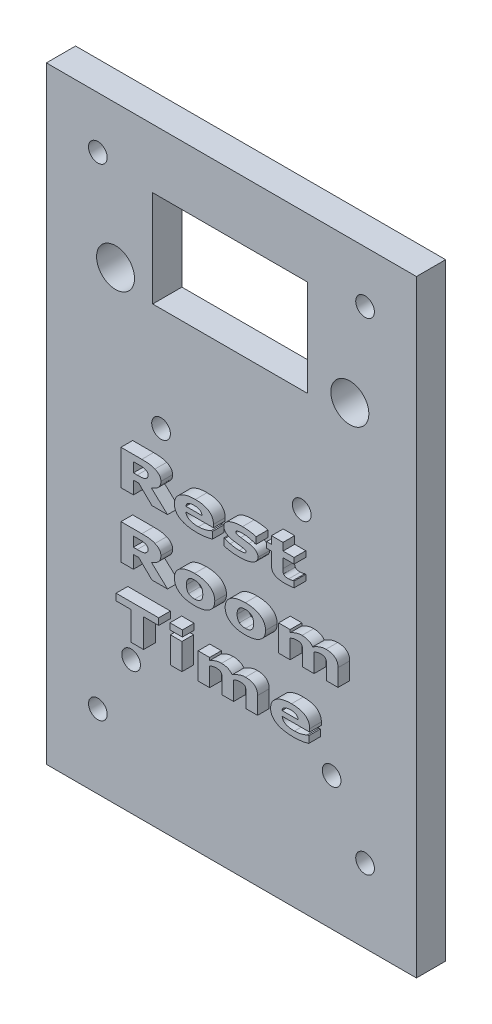
from build123d import *

# Parameters (mm, degrees)
SCHIZZO1_W                   = 63.340006879
SCHIZZO1_H                   = 103.980003745
SCHIZZO1_R                   = 1.6
SCHIZZO1_R_2                 = 3.25
SCHIZZO1_W_2                 = 26.5
SCHIZZO1_H_2                 = 16.5
ESTRUSIONE_ESTRUSIONE1_DEPTH = 5
SCHIZZO4_W                   = 1.974683544
SCHIZZO4_H                   = 4.481012658
SCHIZZO4_W_2                 = 2.126582278
SCHIZZO4_H_2                 = 1.063291139
ESTRUSIONE_ESTRUSIONE2_DEPTH = 2
SCHIZZO5_W                   = 53.340006879
SCHIZZO5_H                   = 93.980003745
SCHIZZO5_W_2                 = 48.340006879
SCHIZZO5_H_2                 = 88.980003745
TAGLIO_ESTRUSIONE1_DEPTH     = 2


with BuildPart() as part:
    # Schizzo1 → Estrusione-Estrusione1 (new body)
    with BuildSketch(Plane.XY):
        with Locations((45.670002815, -4.009999784)):
            Rectangle(SCHIZZO1_W, SCHIZZO1_H)
        with Locations((68.547653378, 39.133270494)):
            Circle(SCHIZZO1_R, mode=Mode.SUBTRACT)
        with Locations((22.813532798, 39.133270494)):
            Circle(SCHIZZO1_R, mode=Mode.SUBTRACT)
        with Locations((68.547653378, -43.377075301)):
            Circle(SCHIZZO1_R, mode=Mode.SUBTRACT)
        with Locations((22.813532798, -43.377075301)):
            Circle(SCHIZZO1_R, mode=Mode.SUBTRACT)
        with Locations((57.711115818, 3.59770492)):
            Circle(SCHIZZO1_R, mode=Mode.SUBTRACT)
        with Locations((33.630602395, 3.59770492)):
            Circle(SCHIZZO1_R, mode=Mode.SUBTRACT)
        with Locations((62.830042897, -33.235000951)):
            Circle(SCHIZZO1_R, mode=Mode.SUBTRACT)
        with Locations((28.504233864, -33.235000951)):
            Circle(SCHIZZO1_R, mode=Mode.SUBTRACT)
        with Locations((65.944072664, 23.559058576)):
            Circle(SCHIZZO1_R_2, mode=Mode.SUBTRACT)
        with Locations((25.84132705, 23.559058576)):
            Circle(SCHIZZO1_R_2, mode=Mode.SUBTRACT)
        with Locations((45.449738172, 29.587574645)):
            Rectangle(SCHIZZO1_W_2, SCHIZZO1_H_2, mode=Mode.SUBTRACT)
    extrude(amount=ESTRUSIONE_ESTRUSIONE1_DEPTH)

    # Schizzo4 → Estrusione-Estrusione2 (add)
    # profile 1 of 13: a face of its own
    with BuildSketch(Plane.XY.offset(5)):
        with BuildLine():
            Line((36.743529831, -6.613542925), (34.068688059, -6.613542925))
            Line((34.068688059, -6.613542925), (31.812754515, -4.411011279))
            Line((31.812754515, -4.411011279), (30.895428566, -4.411011279))
            Line((30.895428566, -4.411011279), (30.895428566, -6.613542925))
            Line((30.895428566, -6.613542925), (28.768846287, -6.613542925))
            Line((28.768846287, -6.613542925), (28.768846287, -0.613542925))
            Line((28.768846287, -0.613542925), (32.342026667, -0.613542925))
            add(Edge.make_bspline(
                [(32.342026667, -0.613542925), (32.459917396, -0.614065362), (32.687061621, -0.615071962), (33.014707426, -0.627201677), (33.316628657, -0.646115842), (33.596480416, -0.670828345), (33.859504462, -0.709843996), (34.111568341, -0.765611436), (34.354933893, -0.839725052), (34.510982371, -0.903482808), (34.58846654, -0.935141026)],
                knots=[0, 0, 0, 0, 1.23763299, 2.384591115, 3.441523635, 4.413457851, 5.333214875, 6.23095678, 7.121600885, 8, 8, 8, 8], degree=3))
            add(Edge.make_bspline(
                [(34.58846654, -0.935141026), (34.662828165, -0.969611464), (34.807841098, -1.036832417), (35.006453319, -1.160387443), (35.180486974, -1.299726487), (35.308001287, -1.427449365), (35.393939486, -1.539598071), (35.451893666, -1.626664821), (35.497379626, -1.720773675), (35.537878824, -1.818112565), (35.566214003, -1.92203166), (35.590097133, -2.029912661), (35.600937137, -2.143785518), (35.603154715, -2.221124715), (35.604289325, -2.260694823)],
                knots=[0, 0, 0, 0, 1.65530834, 3.228024117, 4.71244356, 6.153967778, 6.860706657, 7.565816059, 8.262950144, 8.969553376, 9.693180251, 10.436325727, 11.199956013, 12, 12, 12, 12], degree=3))
            add(Edge.make_bspline(
                [(35.604289325, -2.260694823), (35.602767665, -2.314937192), (35.599792592, -2.42098913), (35.581007834, -2.576490305), (35.547714136, -2.723907142), (35.501214741, -2.863858666), (35.441582966, -2.996281934), (35.369088258, -3.121344871), (35.283182432, -3.238364413), (35.183481498, -3.346628478), (35.072017716, -3.448893568), (34.949789808, -3.547571155), (34.815440793, -3.641008215), (34.670029412, -3.729809198), (34.514393144, -3.815737256), (34.346653152, -3.896133921), (34.167645578, -3.972147018), (34.043190376, -4.017576773), (33.979684895, -4.040758114)],
                knots=[0, 0, 0, 0, 1.003039821, 1.961092798, 2.890919865, 3.793002064, 4.683474046, 5.571690105, 6.461170186, 7.362065434, 8.288578113, 9.256133225, 10.264625474, 11.312124791, 12.4055062, 13.550515092, 14.750106724, 16, 16, 16, 16], degree=3))
            Line((33.979684895, -4.040758114), (36.743529831, -6.613542925))
        make_face()
        with BuildLine():
            add(Edge.make_bspline(
                [(33.401757679, -2.435141026), (33.400163439, -2.397433093), (33.397058864, -2.324001806), (33.372906305, -2.218463078), (33.333005692, -2.121309999), (33.276775361, -2.03189924), (33.199310679, -1.951165726), (33.098636165, -1.881875055), (32.976622049, -1.819646491), (32.885249284, -1.789117141), (32.836884262, -1.772957482)],
                knots=[0, 0, 0, 0, 0.957336641, 1.864288378, 2.734003876, 3.615026844, 4.532001674, 5.555423495, 6.706047712, 8, 8, 8, 8], degree=3))
            add(Edge.make_bspline(
                [(32.836884262, -1.772957482), (32.799824847, -1.762565898), (32.723162959, -1.741069648), (32.60178078, -1.717729622), (32.470926396, -1.701469455), (32.330669185, -1.691468736), (32.18029154, -1.684566442), (32.01887425, -1.679817453), (31.845591764, -1.677797806), (31.72612502, -1.677162318), (31.664415907, -1.676834064)],
                knots=[0, 0, 0, 0, 0.782320133, 1.618323976, 2.510186495, 3.462012448, 4.476573932, 5.570889699, 6.745272239, 8, 8, 8, 8], degree=3))
            Line((31.664415907, -1.676834064), (30.895428566, -1.676834064))
            Line((30.895428566, -1.676834064), (30.895428566, -3.34772014))
            Line((30.895428566, -3.34772014), (31.548118439, -3.34772014))
            add(Edge.make_bspline(
                [(31.548118439, -3.34772014), (31.629613777, -3.347352654), (31.785517863, -3.346649638), (32.00903549, -3.33896879), (32.211747148, -3.329325352), (32.395205307, -3.313105542), (32.561753371, -3.289196691), (32.71344567, -3.252820422), (32.851214785, -3.20325966), (32.934997751, -3.159926151), (32.975729198, -3.13885938)],
                knots=[0, 0, 0, 0, 1.341483331, 2.566315284, 3.681365401, 4.681825093, 5.597229588, 6.448502128, 7.24573266, 8, 8, 8, 8], degree=3))
            add(Edge.make_bspline(
                [(32.975729198, -3.13885938), (33.01056931, -3.117347666), (33.077069526, -3.076287704), (33.166378694, -3.006894065), (33.240036722, -2.933484302), (33.30108752, -2.855377251), (33.347094518, -2.767901896), (33.37871239, -2.668321342), (33.399466087, -2.556252424), (33.400969847, -2.476778222), (33.401757679, -2.435141026)],
                knots=[0, 0, 0, 0, 1.127439998, 2.151973666, 3.107421081, 3.985748692, 4.872887039, 5.813618488, 6.854536536, 8, 8, 8, 8], degree=3))
        make_face(mode=Mode.SUBTRACT)
    # profile 2 of 13: a face of its own
    with BuildSketch(Plane.XY.offset(5)):
        with BuildLine():
            Line((44.596694388, -4.63885938), (39.887833629, -4.63885938))
            add(Edge.make_bspline(
                [(39.887833629, -4.63885938), (39.893060666, -4.683751557), (39.903309035, -4.771769222), (39.93735581, -4.899002348), (39.985522596, -5.018380422), (40.05117156, -5.128532514), (40.129703915, -5.23161132), (40.224572371, -5.325825245), (40.334527932, -5.411190349), (40.459022346, -5.488611876), (40.598703229, -5.557899691), (40.754626468, -5.615929153), (40.925092606, -5.668006791), (41.111607302, -5.70679434), (41.313159104, -5.738942527), (41.529747206, -5.762763991), (41.762289885, -5.775186329), (41.92223466, -5.777106964), (42.004922236, -5.778099887)],
                knots=[0, 0, 0, 0, 0.815752726, 1.5994023, 2.371922207, 3.134423876, 3.90928801, 4.707855741, 5.542889771, 6.419503006, 7.352907879, 8.355149581, 9.422489183, 10.570699908, 11.793989706, 13.109817466, 14.505845598, 16, 16, 16, 16], degree=3))
            add(Edge.make_bspline(
                [(42.004922236, -5.778099887), (42.111809273, -5.776079306), (42.324875807, -5.77205152), (42.64118628, -5.738671201), (42.95294425, -5.686935661), (43.254423725, -5.61352446), (43.537245144, -5.527890777), (43.793709496, -5.439239935), (44.018767743, -5.348376994), (44.154472464, -5.279000308), (44.218134262, -5.246454317)],
                knots=[0, 0, 0, 0, 1.116833883, 2.226274866, 3.32050695, 4.417476773, 5.466421047, 6.407786068, 7.253060613, 8, 8, 8, 8], degree=3))
            Line((44.218134262, -5.246454317), (44.444795654, -5.246454317))
            Line((44.444795654, -5.246454317), (44.444795654, -6.395188494))
            add(Edge.make_bspline(
                [(44.444795654, -6.395188494), (44.333069665, -6.42649208), (44.113327136, -6.488059932), (43.786051191, -6.564270257), (43.468749928, -6.628840288), (43.15740151, -6.681231703), (42.842560588, -6.719235554), (42.516023671, -6.746680506), (42.173177741, -6.761529855), (41.939270694, -6.764119116), (41.819795654, -6.765441659)],
                knots=[0, 0, 0, 0, 1.046505789, 2.058266218, 3.03026014, 3.967069247, 4.90533822, 5.890014156, 6.922261439, 8, 8, 8, 8], degree=3))
            add(Edge.make_bspline(
                [(41.819795654, -6.765441659), (41.666668626, -6.763698158), (41.369627981, -6.760316059), (40.937402893, -6.732007126), (40.533083103, -6.683307625), (40.155667024, -6.61856805), (39.806704506, -6.531064245), (39.484003319, -6.42835347), (39.189318525, -6.303406355), (38.964265185, -6.182145397), (38.798661336, -6.076906004), (38.68485766, -5.993165278), (38.577787187, -5.907451021), (38.479899714, -5.81582678), (38.388548834, -5.722039991), (38.306107374, -5.622485429), (38.231714089, -5.519113566), (38.162897943, -5.412687971), (38.105913599, -5.29995516), (38.052466259, -5.185631144), (38.01033072, -5.065669352), (37.974327411, -4.942604318), (37.947370565, -4.814774608), (37.927051488, -4.683301084), (37.914903792, -4.547713633), (37.913739016, -4.456130578), (37.913150085, -4.40982457)],
                knots=[0, 0, 0, 0, 2.156393342, 4.183039893, 6.096393803, 7.889708536, 9.571876182, 11.159187607, 12.654365993, 14.072667969, 14.754162861, 15.416044098, 16.061618173, 16.684462124, 17.303031152, 17.904325619, 18.502722763, 19.096198601, 19.686738758, 20.280110001, 20.872198447, 21.475193746, 22.084894033, 22.710472495, 23.347992148, 24, 24, 24, 24], degree=3))
            add(Edge.make_bspline(
                [(37.913150085, -4.40982457), (37.916033268, -4.318643586), (37.921673664, -4.140265431), (37.968348047, -3.880016597), (38.04271935, -3.634211536), (38.147754463, -3.402633719), (38.285396009, -3.187429284), (38.451029413, -2.985683068), (38.648019514, -2.800014884), (38.872516582, -2.628960793), (39.124463166, -2.477525594), (39.397961199, -2.341922539), (39.69574842, -2.231783687), (40.013964096, -2.1385895), (40.355107656, -2.06877487), (40.717515135, -2.01584886), (41.10295434, -1.987150618), (41.367220577, -1.982843575), (41.502944388, -1.980631532)],
                knots=[0, 0, 0, 0, 0.900707721, 1.762062369, 2.604321683, 3.433667978, 4.2667202, 5.122278432, 6.007259721, 6.936273877, 7.906562426, 8.908506855, 9.949130078, 11.040455975, 12.183024346, 13.387882921, 14.658449562, 16, 16, 16, 16], degree=3))
            add(Edge.make_bspline(
                [(41.502944388, -1.980631532), (41.627596517, -1.982027035), (41.868887111, -1.984728325), (42.219174348, -2.011122042), (42.5453233, -2.054505932), (42.848204993, -2.114142502), (43.126698946, -2.192525999), (43.38197635, -2.286464764), (43.613050703, -2.39983624), (43.820072491, -2.530172734), (44.003866017, -2.676926677), (44.162329819, -2.840486519), (44.297755343, -3.01816296), (44.408473738, -3.211422576), (44.492619725, -3.420938427), (44.552644245, -3.64525745), (44.590712442, -3.884401989), (44.594666014, -4.048917167), (44.596694388, -4.133321406)],
                knots=[0, 0, 0, 0, 1.401136945, 2.712197293, 3.946129402, 5.098199997, 6.179386588, 7.195357877, 8.15196001, 9.067385085, 9.940371348, 10.789472137, 11.621064783, 12.445672393, 13.285499767, 14.151743494, 15.051755079, 16, 16, 16, 16], degree=3))
            Line((44.596694388, -4.133321406), (44.596694388, -4.63885938))
        make_face()
        with BuildLine():
            add(Edge.make_bspline(
                [(42.622010844, -3.803416342), (42.619492739, -3.769718624), (42.614602945, -3.704282555), (42.596696457, -3.609493848), (42.569439691, -3.521005065), (42.532564246, -3.439008375), (42.486977504, -3.363139533), (42.432238369, -3.293814095), (42.367094422, -3.231793211), (42.293299234, -3.17563767), (42.208958738, -3.126866479), (42.114360863, -3.083994324), (42.009051854, -3.047703609), (41.892805284, -3.017800267), (41.766097171, -2.996234936), (41.628734711, -2.979184574), (41.480515579, -2.970225079), (41.377954581, -2.968740647), (41.324938059, -2.967973304)],
                knots=[0, 0, 0, 0, 0.932139821, 1.810080023, 2.656144755, 3.482032483, 4.285310903, 5.093545367, 5.912038884, 6.761478327, 7.647191353, 8.59505604, 9.624025466, 10.717690014, 11.904201741, 13.169053196, 14.536607931, 16, 16, 16, 16], degree=3))
            add(Edge.make_bspline(
                [(41.324938059, -2.967973304), (41.275095204, -2.96889922), (41.177715741, -2.970708208), (41.03493263, -2.977740355), (40.899754589, -2.995637761), (40.77065808, -3.01580389), (40.649035231, -3.045245989), (40.532799292, -3.076963611), (40.425111322, -3.120042402), (40.322818579, -3.164732973), (40.230021724, -3.218268189), (40.146856655, -3.278809887), (40.07590112, -3.348217115), (40.013458079, -3.423780163), (39.964517796, -3.508457613), (39.924142194, -3.599642006), (39.897371889, -3.69904615), (39.887137184, -3.768087751), (39.881900085, -3.803416342)],
                knots=[0, 0, 0, 0, 1.299904305, 2.539661586, 3.72426531, 4.853518015, 5.944294499, 6.985577514, 7.991157631, 8.965086312, 9.893841863, 10.778785638, 11.639476424, 12.47546522, 13.326273753, 14.180824864, 15.069127983, 16, 16, 16, 16], degree=3))
            Line((39.881900085, -3.803416342), (42.622010844, -3.803416342))
        make_face(mode=Mode.SUBTRACT)
    # profile 3 of 13: a face of its own
    with BuildSketch(Plane.XY.offset(5)):
        with BuildLine():
            add(Edge.make_bspline(
                [(52.222010844, -5.202546089), (52.219759639, -5.259779994), (52.215289189, -5.373435266), (52.171465098, -5.538536279), (52.10322149, -5.695451659), (52.006262024, -5.842761263), (51.882712387, -5.981396057), (51.730673112, -6.109133059), (51.554164487, -6.231268974), (51.34993382, -6.340684683), (51.123900658, -6.441951503), (50.875572747, -6.527246215), (50.608550918, -6.60306266), (50.320166873, -6.660538395), (50.01305497, -6.708681669), (49.685380157, -6.740862984), (49.33817694, -6.761387051), (49.099810736, -6.764067046), (48.977548819, -6.765441659)],
                knots=[0, 0, 0, 0, 0.695242776, 1.380615357, 2.063956096, 2.770310233, 3.517108837, 4.316009042, 5.181306846, 6.124909698, 7.131333953, 8.192534391, 9.317354372, 10.50696049, 11.768581374, 13.099289541, 14.512178257, 16, 16, 16, 16], degree=3))
            add(Edge.make_bspline(
                [(48.977548819, -6.765441659), (48.841843033, -6.764035279), (48.576606863, -6.761286519), (48.188237403, -6.741012128), (47.819134115, -6.707419505), (47.472229866, -6.658356537), (47.152005575, -6.601385712), (46.862649801, -6.542513841), (46.605981007, -6.482223014), (46.448071401, -6.434306351), (46.373909578, -6.411802418)],
                knots=[0, 0, 0, 0, 1.235089918, 2.413976085, 3.538525044, 4.607254729, 5.601666222, 6.498392537, 7.294774088, 8, 8, 8, 8], degree=3))
            Line((46.373909578, -6.411802418), (46.373909578, -5.246454317))
            Line((46.373909578, -5.246454317), (46.557849452, -5.246454317))
            add(Edge.make_bspline(
                [(46.557849452, -5.246454317), (46.611573922, -5.270743303), (46.72635179, -5.322634706), (46.877916982, -5.387711741), (47.019478709, -5.44169241), (47.14919495, -5.485596462), (47.299375731, -5.530096633), (47.406669505, -5.558822172), (47.463308312, -5.573985963)],
                knots=[0, 0, 0, 0, 1.100340934, 2.350787024, 3.077434952, 3.92718755, 4.905792744, 6, 6, 6, 6], degree=3))
            add(Edge.make_bspline(
                [(47.463308312, -5.573985963), (47.517039357, -5.587705159), (47.627309821, -5.615860617), (47.798560596, -5.654001114), (47.980385496, -5.687786442), (48.17162685, -5.720328692), (48.372215324, -5.746941947), (48.580204421, -5.763384607), (48.795024251, -5.776621064), (48.940342888, -5.777600946), (49.014336793, -5.778099887)],
                knots=[0, 0, 0, 0, 0.848309791, 1.74095843, 2.683297014, 3.677135311, 4.708439524, 5.777335295, 6.868254989, 8, 8, 8, 8], degree=3))
            add(Edge.make_bspline(
                [(49.014336793, -5.778099887), (49.061810096, -5.777998935), (49.153618523, -5.777803706), (49.286557029, -5.772731476), (49.410387776, -5.765593511), (49.524487392, -5.756907449), (49.628903859, -5.743378282), (49.723532074, -5.728177612), (49.809353642, -5.711001403), (49.885296985, -5.68939827), (49.952748725, -5.666161205), (50.010314846, -5.638660392), (50.060257078, -5.61078623), (50.100387076, -5.578207006), (50.131050392, -5.5424571), (50.155165002, -5.505046581), (50.168355745, -5.463675054), (50.170366007, -5.435222807), (50.171377933, -5.42090052)],
                knots=[0, 0, 0, 0, 1.754922561, 3.393837643, 4.917246669, 6.340576006, 7.622979822, 8.808233368, 9.883757409, 10.855995801, 11.725592256, 12.517173403, 13.211921573, 13.835453321, 14.416003467, 14.947716567, 15.470301736, 16, 16, 16, 16], degree=3))
            add(Edge.make_bspline(
                [(50.171377933, -5.42090052), (50.169465997, -5.394834868), (50.165781521, -5.344603975), (50.132515241, -5.274756339), (50.07631431, -5.219017632), (50.013917362, -5.185020276), (49.95421608, -5.160395902), (49.89743471, -5.143340176), (49.832053836, -5.124035233), (49.756619492, -5.106697862), (49.672344955, -5.088960016), (49.578314458, -5.070713728), (49.474359663, -5.055139126), (49.401984416, -5.043588994), (49.364415907, -5.037593558)],
                knots=[0, 0, 0, 0, 0.965884004, 1.86134671, 2.808544282, 3.863828688, 4.484314242, 5.21050087, 6.067767429, 7.021007244, 8.089147759, 9.272750088, 10.584340436, 12, 12, 12, 12], degree=3))
            add(Edge.make_bspline(
                [(49.364415907, -5.037593558), (49.324099664, -5.031045126), (49.236510854, -5.016818371), (49.09467642, -4.998901761), (48.932639328, -4.977869647), (48.755117156, -4.959561323), (48.572231212, -4.937859806), (48.393959777, -4.91228807), (48.223911272, -4.887300137), (48.113956204, -4.866292976), (48.060222869, -4.856027102)],
                knots=[0, 0, 0, 0, 0.744214768, 1.616839283, 2.604767253, 3.721554734, 4.868636585, 5.960393255, 7.003275847, 8, 8, 8, 8], degree=3))
            add(Edge.make_bspline(
                [(48.060222869, -4.856027102), (47.990861021, -4.842418086), (47.856247502, -4.816006485), (47.662607813, -4.767187361), (47.482717975, -4.712759097), (47.316781702, -4.652380711), (47.163937054, -4.587226137), (47.02476711, -4.516456264), (46.899883219, -4.439228859), (46.788348683, -4.357079663), (46.690331894, -4.269035068), (46.605770632, -4.17501326), (46.533952194, -4.0760697), (46.475020726, -3.971930688), (46.429734569, -3.862253207), (46.397987439, -3.747044893), (46.376557954, -3.626998476), (46.374799989, -3.544808351), (46.373909578, -3.503179001)],
                knots=[0, 0, 0, 0, 1.436910973, 2.788674871, 4.058194714, 5.256528725, 6.376980573, 7.434471268, 8.427648006, 9.358983182, 10.247307462, 11.101556827, 11.925237091, 12.728280823, 13.528823734, 14.330860009, 15.154579535, 16, 16, 16, 16], degree=3))
            add(Edge.make_bspline(
                [(46.373909578, -3.503179001), (46.376248574, -3.449506646), (46.380891302, -3.342971103), (46.423608555, -3.187685491), (46.491101019, -3.039374353), (46.586073027, -2.898250466), (46.709659443, -2.766141291), (46.858210731, -2.640273829), (47.032333383, -2.519985116), (47.233281544, -2.409836505), (47.456226844, -2.308022809), (47.700687622, -2.22087344), (47.963940549, -2.146168601), (48.246887201, -2.084633102), (48.549676286, -2.037633286), (48.871756193, -2.005237596), (49.213040831, -1.984657171), (49.447059187, -1.981998217), (49.567343123, -1.980631532)],
                knots=[0, 0, 0, 0, 0.66642162, 1.322796246, 1.987745069, 2.686423757, 3.428127259, 4.230760498, 5.104236181, 6.055709831, 7.077361036, 8.149694254, 9.280365811, 10.478985555, 11.748965885, 13.089424735, 14.503982965, 16, 16, 16, 16], degree=3))
            add(Edge.make_bspline(
                [(49.567343123, -1.980631532), (49.68287515, -1.981676304), (49.912120572, -1.9837494), (50.252196788, -2.003200245), (50.585093267, -2.035176637), (50.905891936, -2.07902864), (51.205807856, -2.128955888), (51.47517122, -2.182516027), (51.709787791, -2.235134647), (51.852344221, -2.277778787), (51.918213376, -2.297482798)],
                knots=[0, 0, 0, 0, 1.165069486, 2.311799166, 3.434006637, 4.537017677, 5.576539971, 6.499751617, 7.306800165, 8, 8, 8, 8], degree=3))
            Line((51.918213376, -2.297482798), (51.918213376, -3.423669507))
            Line((51.918213376, -3.423669507), (51.744953882, -3.423669507))
            add(Edge.make_bspline(
                [(51.744953882, -3.423669507), (51.668599182, -3.390646175), (51.512182518, -3.322996124), (51.264538476, -3.238103965), (51.002453351, -3.158930792), (50.726528106, -3.092746999), (50.442587798, -3.036078511), (50.153990461, -2.997791917), (49.863665366, -2.972937137), (49.669450724, -2.969630792), (49.572089958, -2.967973304)],
                knots=[0, 0, 0, 0, 0.892773515, 1.82889402, 2.808358008, 3.831127153, 4.873846771, 5.915251133, 6.954905017, 8, 8, 8, 8], degree=3))
            add(Edge.make_bspline(
                [(49.572089958, -2.967973304), (49.494534739, -2.969173473), (49.345563467, -2.971478808), (49.131346621, -2.987199505), (48.936308926, -3.016980336), (48.787338619, -3.050586907), (48.680508808, -3.082190395), (48.61339279, -3.109661583), (48.555609248, -3.137583681), (48.508140242, -3.168675052), (48.470733635, -3.202906151), (48.444107581, -3.240067292), (48.426800933, -3.279837812), (48.425300237, -3.307596389), (48.42454249, -3.321612545)],
                knots=[0, 0, 0, 0, 2.189436495, 4.205560168, 6.058098144, 7.753859234, 8.513294714, 9.199676881, 9.798958915, 10.322378589, 10.796415771, 11.220907212, 11.606612184, 12, 12, 12, 12], degree=3))
            add(Edge.make_bspline(
                [(48.42454249, -3.321612545), (48.426178685, -3.347250757), (48.429360463, -3.397107347), (48.459999607, -3.466098051), (48.508253175, -3.52564575), (48.56503354, -3.56437749), (48.622557323, -3.592713686), (48.680716029, -3.610950312), (48.750253006, -3.633528899), (48.832918657, -3.653779018), (48.928424091, -3.675957505), (49.036893944, -3.694616626), (49.157682502, -3.717041392), (49.24253841, -3.73008384), (49.287279831, -3.736960646)],
                knots=[0, 0, 0, 0, 0.884868041, 1.72073244, 2.569224073, 3.513366885, 4.077862176, 4.789416373, 5.622574242, 6.614167188, 7.739149507, 9.02269217, 10.430174323, 12, 12, 12, 12], degree=3))
            add(Edge.make_bspline(
                [(49.287279831, -3.736960646), (49.393656181, -3.751845284), (49.614564644, -3.782755748), (49.955064846, -3.825363734), (50.308866531, -3.869421294), (50.546129327, -3.910827513), (50.665048819, -3.931580899)],
                knots=[0, 0, 0, 0, 0.926215679, 1.923443356, 2.959200237, 4, 4, 4, 4], degree=3))
            add(Edge.make_bspline(
                [(50.665048819, -3.931580899), (50.729249224, -3.944494493), (50.853840819, -3.969555476), (51.033180121, -4.01482712), (51.200110737, -4.06442767), (51.354194502, -4.11951084), (51.495200586, -4.181692597), (51.623242233, -4.248589277), (51.737956014, -4.321753915), (51.841053213, -4.398326565), (51.929953361, -4.482056671), (52.00828381, -4.56943121), (52.075552311, -4.661861609), (52.128483, -4.760932642), (52.171040272, -4.86414396), (52.200316018, -4.972604745), (52.218756647, -5.086013482), (52.220915246, -5.163312789), (52.222010844, -5.202546089)],
                knots=[0, 0, 0, 0, 1.430413789, 2.775956541, 4.03902733, 5.23358023, 6.347891222, 7.403174158, 8.386060264, 9.317614526, 10.204152737, 11.048807091, 11.878565892, 12.694439193, 13.496791728, 14.312298839, 15.143406476, 16, 16, 16, 16], degree=3))
        make_face()
    # profile 4 of 13: a face of its own
    with BuildSketch(Plane.XY.offset(5)):
        with BuildLine():
            add(Edge.make_bspline(
                [(58.404289325, -6.634903684), (58.293686069, -6.654126698), (58.066902235, -6.693542074), (57.774640861, -6.727353616), (57.523561536, -6.747961787), (57.312616266, -6.758310955), (57.081535619, -6.763887354), (56.920510825, -6.764909376), (56.83664692, -6.765441659)],
                knots=[0, 0, 0, 0, 1.282364452, 2.629393912, 3.35936795, 4.16031599, 5.041867524, 6, 6, 6, 6], degree=3))
            add(Edge.make_bspline(
                [(56.83664692, -6.765441659), (56.742482778, -6.764154621), (56.560353799, -6.761665276), (56.296142659, -6.746789951), (56.050901027, -6.719922155), (55.824391583, -6.681686087), (55.615810543, -6.635264686), (55.425928724, -6.576435925), (55.254789901, -6.506056371), (55.101258839, -6.426090874), (54.966060949, -6.331105393), (54.848797507, -6.221711851), (54.750000951, -6.095843024), (54.668934093, -5.955310555), (54.607286276, -5.798307361), (54.562210521, -5.627150941), (54.536487824, -5.440263742), (54.532787638, -5.311010815), (54.530871604, -5.244080899)],
                knots=[0, 0, 0, 0, 1.42977543, 2.765421456, 4.016342265, 5.173579602, 6.251760214, 7.258571824, 8.187680262, 9.058217613, 9.88140869, 10.688736841, 11.484181279, 12.302163, 13.14310763, 14.037598323, 14.983826646, 16, 16, 16, 16], degree=3))
            Line((54.530871604, -5.244080899), (54.530871604, -3.119872039))
            Line((54.530871604, -3.119872039), (53.695428566, -3.119872039))
            Line((53.695428566, -3.119872039), (53.695428566, -2.132530266))
            Line((53.695428566, -2.132530266), (54.530871604, -2.132530266))
            Line((54.530871604, -2.132530266), (54.530871604, -0.841391026))
            Line((54.530871604, -0.841391026), (56.505555148, -0.841391026))
            Line((56.505555148, -0.841391026), (56.505555148, -2.132530266))
            Line((56.505555148, -2.132530266), (58.404289325, -2.132530266))
            Line((58.404289325, -2.132530266), (58.404289325, -3.119872039))
            Line((58.404289325, -3.119872039), (56.505555148, -3.119872039))
            Line((56.505555148, -3.119872039), (56.505555148, -4.73260938))
            add(Edge.make_bspline(
                [(56.505555148, -4.73260938), (56.506070703, -4.806973986), (56.507036066, -4.946219779), (56.506677557, -5.114504784), (56.516473306, -5.236199858), (56.535002639, -5.318893277), (56.561080437, -5.397931897), (56.588211598, -5.445797003), (56.601678566, -5.469555583)],
                knots=[0, 0, 0, 0, 1.777093507, 3.327561429, 4.020758447, 4.688214113, 5.348874962, 6, 6, 6, 6], degree=3))
            add(Edge.make_bspline(
                [(56.601678566, -5.469555583), (56.616081249, -5.492941999), (56.645678579, -5.541000784), (56.711725897, -5.59906415), (56.788106012, -5.654257163), (56.88310034, -5.698835984), (56.996596457, -5.736806028), (57.132693328, -5.758786475), (57.290281816, -5.776828041), (57.403031492, -5.777657196), (57.463229198, -5.778099887)],
                knots=[0, 0, 0, 0, 0.684983813, 1.407632939, 2.183580387, 3.0441003, 4.025775169, 5.175442731, 6.491952455, 8, 8, 8, 8], degree=3))
            add(Edge.make_bspline(
                [(57.463229198, -5.778099887), (57.491728429, -5.777228682), (57.552810945, -5.775361425), (57.650294107, -5.765401329), (57.75992703, -5.748433039), (57.876501917, -5.725317254), (57.990043279, -5.700350904), (58.089763532, -5.676381138), (58.16962799, -5.65155655), (58.215671434, -5.633907674), (58.235776667, -5.626201152)],
                knots=[0, 0, 0, 0, 0.86555091, 1.855138802, 2.972882942, 4.233134932, 5.462970253, 6.502955579, 7.346303766, 8, 8, 8, 8], degree=3))
            Line((58.235776667, -5.626201152), (58.404289325, -5.626201152))
            Line((58.404289325, -5.626201152), (58.404289325, -6.634903684))
        make_face()
    # profile 5 of 13: a face of its own
    with BuildSketch(Plane.XY.offset(5)):
        with BuildLine():
            Line((36.743529831, -17.63885938), (34.068688059, -17.63885938))
            Line((34.068688059, -17.63885938), (31.812754515, -15.436327735))
            Line((31.812754515, -15.436327735), (30.895428566, -15.436327735))
            Line((30.895428566, -15.436327735), (30.895428566, -17.63885938))
            Line((30.895428566, -17.63885938), (28.768846287, -17.63885938))
            Line((28.768846287, -17.63885938), (28.768846287, -11.63885938))
            Line((28.768846287, -11.63885938), (32.342026667, -11.63885938))
            add(Edge.make_bspline(
                [(32.342026667, -11.63885938), (32.459917396, -11.639381818), (32.687061621, -11.640388418), (33.014707426, -11.652518133), (33.316628657, -11.671432298), (33.596480416, -11.6961448), (33.859504462, -11.735160451), (34.111568341, -11.790927891), (34.354933893, -11.865041508), (34.510982371, -11.928799263), (34.58846654, -11.960457482)],
                knots=[0, 0, 0, 0, 1.23763299, 2.384591115, 3.441523635, 4.413457851, 5.333214875, 6.23095678, 7.121600885, 8, 8, 8, 8], degree=3))
            add(Edge.make_bspline(
                [(34.58846654, -11.960457482), (34.662828165, -11.994927919), (34.807841098, -12.062148872), (35.006453319, -12.185703899), (35.180486974, -12.325042943), (35.308001287, -12.452765821), (35.393939486, -12.564914526), (35.451893666, -12.651981276), (35.497379626, -12.746090131), (35.537878824, -12.843429021), (35.566214003, -12.947348116), (35.590097133, -13.055229117), (35.600937137, -13.169101973), (35.603154715, -13.246441171), (35.604289325, -13.286011279)],
                knots=[0, 0, 0, 0, 1.65530834, 3.228024117, 4.71244356, 6.153967778, 6.860706657, 7.565816059, 8.262950144, 8.969553376, 9.693180251, 10.436325727, 11.199956013, 12, 12, 12, 12], degree=3))
            add(Edge.make_bspline(
                [(35.604289325, -13.286011279), (35.602767665, -13.340253647), (35.599792592, -13.446305586), (35.581007834, -13.60180676), (35.547714136, -13.749223598), (35.501214741, -13.889175121), (35.441582966, -14.02159839), (35.369088258, -14.146661327), (35.283182432, -14.263680869), (35.183481498, -14.371944933), (35.072017716, -14.474210024), (34.949789808, -14.57288761), (34.815440793, -14.666324671), (34.670029412, -14.755125653), (34.514393144, -14.841053712), (34.346653152, -14.921450376), (34.167645578, -14.997463473), (34.043190376, -15.042893229), (33.979684895, -15.06607457)],
                knots=[0, 0, 0, 0, 1.003039821, 1.961092798, 2.890919865, 3.793002064, 4.683474046, 5.571690105, 6.461170186, 7.362065434, 8.288578113, 9.256133225, 10.264625474, 11.312124791, 12.4055062, 13.550515092, 14.750106724, 16, 16, 16, 16], degree=3))
            Line((33.979684895, -15.06607457), (36.743529831, -17.63885938))
        make_face()
        with BuildLine():
            add(Edge.make_bspline(
                [(33.401757679, -13.460457482), (33.400163439, -13.422749549), (33.397058864, -13.349318262), (33.372906305, -13.243779534), (33.333005692, -13.146626455), (33.276775361, -13.057215696), (33.199310679, -12.976482182), (33.098636165, -12.90719151), (32.976622049, -12.844962947), (32.885249284, -12.814433596), (32.836884262, -12.798273937)],
                knots=[0, 0, 0, 0, 0.957336641, 1.864288378, 2.734003876, 3.615026844, 4.532001674, 5.555423495, 6.706047712, 8, 8, 8, 8], degree=3))
            add(Edge.make_bspline(
                [(32.836884262, -12.798273937), (32.799824847, -12.787882353), (32.723162959, -12.766386103), (32.60178078, -12.743046078), (32.470926396, -12.726785911), (32.330669185, -12.716785192), (32.18029154, -12.709882897), (32.01887425, -12.705133909), (31.845591764, -12.703114262), (31.72612502, -12.702478773), (31.664415907, -12.70215052)],
                knots=[0, 0, 0, 0, 0.782320133, 1.618323976, 2.510186495, 3.462012448, 4.476573932, 5.570889699, 6.745272239, 8, 8, 8, 8], degree=3))
            Line((31.664415907, -12.70215052), (30.895428566, -12.70215052))
            Line((30.895428566, -12.70215052), (30.895428566, -14.373036596))
            Line((30.895428566, -14.373036596), (31.548118439, -14.373036596))
            add(Edge.make_bspline(
                [(31.548118439, -14.373036596), (31.629613777, -14.37266911), (31.785517863, -14.371966094), (32.00903549, -14.364285246), (32.211747148, -14.354641808), (32.395205307, -14.338421998), (32.561753371, -14.314513146), (32.71344567, -14.278136878), (32.851214785, -14.228576115), (32.934997751, -14.185242607), (32.975729198, -14.164175836)],
                knots=[0, 0, 0, 0, 1.341483331, 2.566315284, 3.681365401, 4.681825093, 5.597229588, 6.448502128, 7.24573266, 8, 8, 8, 8], degree=3))
            add(Edge.make_bspline(
                [(32.975729198, -14.164175836), (33.01056931, -14.142664121), (33.077069526, -14.10160416), (33.166378694, -14.032210521), (33.240036722, -13.958800757), (33.30108752, -13.880693707), (33.347094518, -13.793218351), (33.37871239, -13.693637798), (33.399466087, -13.58156888), (33.400969847, -13.502094677), (33.401757679, -13.460457482)],
                knots=[0, 0, 0, 0, 1.127439998, 2.151973666, 3.107421081, 3.985748692, 4.872887039, 5.813618488, 6.854536536, 8, 8, 8, 8], degree=3))
        make_face(mode=Mode.SUBTRACT)
    # profile 6 of 13: a face of its own
    with BuildSketch(Plane.XY.offset(5)):
        with BuildLine():
            add(Edge.make_bspline(
                [(44.82454249, -15.400726469), (44.821946717, -15.491090861), (44.816872531, -15.667734149), (44.773037205, -15.92520874), (44.701489163, -16.167680685), (44.60321337, -16.396760585), (44.47287023, -16.609010711), (44.316730823, -16.80821704), (44.129238631, -16.989593517), (43.916670861, -17.157511505), (43.677269026, -17.306128512), (43.415477634, -17.437449106), (43.12956341, -17.545974466), (42.821686717, -17.636035198), (42.490745, -17.705661834), (42.137015123, -17.754361214), (41.760653966, -17.786373363), (41.501826885, -17.789269918), (41.368846287, -17.790758114)],
                knots=[0, 0, 0, 0, 0.917898004, 1.794296614, 2.64532005, 3.48256706, 4.319601691, 5.169751035, 6.048212758, 6.964295287, 7.918022915, 8.906886949, 9.936469457, 11.021631355, 12.164168933, 13.370079207, 14.648795023, 16, 16, 16, 16], degree=3))
            add(Edge.make_bspline(
                [(41.368846287, -17.790758114), (41.235865825, -17.789269553), (40.977039009, -17.786372288), (40.600675982, -17.75436515), (40.246952629, -17.705648292), (39.915988427, -17.636081898), (39.607834743, -17.545709127), (39.321318046, -17.437735461), (39.059221048, -17.306121964), (38.819931193, -17.157428586), (38.607141448, -16.990085983), (38.421219312, -16.807326919), (38.263126431, -16.609887543), (38.135179927, -16.395989194), (38.034239451, -16.168280466), (37.965174027, -15.924915864), (37.920676447, -15.667782999), (37.915697259, -15.491107393), (37.913150085, -15.400726469)],
                knots=[0, 0, 0, 0, 1.351054263, 2.629627452, 3.835403219, 4.977813358, 6.062854217, 7.096074405, 8.084828142, 9.03844939, 9.95442974, 10.829928076, 11.682478698, 12.517341831, 13.356105673, 14.205903522, 15.082204378, 16, 16, 16, 16], degree=3))
            add(Edge.make_bspline(
                [(37.913150085, -15.400726469), (37.915766109, -15.309967669), (37.920891513, -15.13214997), (37.964594313, -14.873113816), (38.03589792, -14.628735363), (38.135775004, -14.399420442), (38.26568657, -14.185644742), (38.424787762, -13.988152014), (38.611930604, -13.805393144), (38.825956381, -13.638202287), (39.065995875, -13.489000846), (39.329687175, -13.360112619), (39.614902264, -13.2491217), (39.92267217, -13.159443956), (40.253020279, -13.091389424), (40.605012216, -13.042314745), (40.979411902, -13.010345594), (41.236657615, -13.007440701), (41.368846287, -13.005947988)],
                knots=[0, 0, 0, 0, 0.92127151, 1.804986201, 2.659271183, 3.50122422, 4.337676625, 5.192235518, 6.0700862, 6.988690861, 7.945161455, 8.935149011, 9.965465435, 11.049872514, 12.186855544, 13.387949211, 14.657767622, 16, 16, 16, 16], degree=3))
            add(Edge.make_bspline(
                [(41.368846287, -13.005947988), (41.502617034, -13.007441758), (41.763022054, -13.010349607), (42.14136914, -13.042266392), (42.496670007, -13.091065029), (42.828423579, -13.160560397), (43.137260101, -13.250673398), (43.422911969, -13.360266759), (43.684840151, -13.491496029), (43.922214326, -13.641822583), (44.134536259, -13.809361822), (44.319869715, -13.99213998), (44.475806077, -14.191361691), (44.603901256, -14.40484689), (44.70270028, -14.633712354), (44.774572011, -14.876137159), (44.8164712, -15.133845845), (44.821810234, -15.310383261), (44.82454249, -15.400726469)],
                knots=[0, 0, 0, 0, 1.357601103, 2.642776179, 3.851205509, 4.996290954, 6.080141775, 7.113672835, 8.097752252, 9.049074211, 9.960898969, 10.838262593, 11.684903135, 12.522294682, 13.358530143, 14.208525385, 15.083210986, 16, 16, 16, 16], degree=3))
        make_face()
        with BuildLine():
            add(Edge.make_bspline(
                [(42.368055148, -16.510299254), (42.400441736, -16.4805704), (42.464945856, -16.421359671), (42.548016451, -16.320070613), (42.617386316, -16.209281727), (42.675994698, -16.087955318), (42.721819997, -15.949396725), (42.75243982, -15.789533025), (42.771339295, -15.606878697), (42.773019851, -15.477519381), (42.773909578, -15.409033431)],
                knots=[0, 0, 0, 0, 0.86696454, 1.726726611, 2.575893528, 3.441978633, 4.380233886, 5.447527619, 6.648659413, 8, 8, 8, 8], degree=3))
            add(Edge.make_bspline(
                [(42.773909578, -15.409033431), (42.773140499, -15.344481142), (42.771664167, -15.220566029), (42.750252782, -15.04295342), (42.720330265, -14.880942846), (42.672728765, -14.735939873), (42.615891479, -14.605289436), (42.548222164, -14.488352644), (42.47011782, -14.384808541), (42.408836293, -14.326777904), (42.378735528, -14.298273937)],
                knots=[0, 0, 0, 0, 1.273591531, 2.444796908, 3.527654896, 4.520510019, 5.45066004, 6.336062214, 7.182693322, 8, 8, 8, 8], degree=3))
            add(Edge.make_bspline(
                [(42.378735528, -14.298273937), (42.34691659, -14.271732573), (42.283023996, -14.218437376), (42.174861586, -14.152866811), (42.056855068, -14.100996728), (41.930389694, -14.061270884), (41.797829031, -14.030514695), (41.65932885, -14.009550602), (41.515864821, -13.996167592), (41.418322581, -13.99425824), (41.368846287, -13.99328976)],
                knots=[0, 0, 0, 0, 0.921207026, 1.849788518, 2.803569296, 3.783602333, 4.795847568, 5.82930983, 6.898962092, 8, 8, 8, 8], degree=3))
            add(Edge.make_bspline(
                [(41.368846287, -13.99328976), (41.319775075, -13.993923668), (41.224674045, -13.995152196), (41.085991065, -14.006053619), (40.955605099, -14.023690892), (40.831807657, -14.048008135), (40.713256924, -14.083840245), (40.599013446, -14.134090485), (40.487372995, -14.198922922), (40.417394658, -14.251258351), (40.381504515, -14.278099887)],
                knots=[0, 0, 0, 0, 1.121786455, 2.174045472, 3.178094466, 4.128792467, 5.055705093, 6.003387049, 6.975987038, 8, 8, 8, 8], degree=3))
            add(Edge.make_bspline(
                [(40.381504515, -14.278099887), (40.350641481, -14.306201224), (40.287486624, -14.363704836), (40.206077915, -14.466778733), (40.134845144, -14.584297828), (40.072505942, -14.715914023), (40.022037759, -14.864098272), (39.989273345, -15.030500908), (39.967259867, -15.213824554), (39.964974984, -15.342109301), (39.963782996, -15.409033431)],
                knots=[0, 0, 0, 0, 0.803442798, 1.644080548, 2.520169973, 3.447822259, 4.44598439, 5.528570587, 6.710694254, 8, 8, 8, 8], degree=3))
            add(Edge.make_bspline(
                [(39.963782996, -15.409033431), (39.964737827, -15.4692168), (39.966589831, -15.5859493), (39.986054021, -15.75460241), (40.016477541, -15.911157533), (40.059070328, -16.055110461), (40.112779822, -16.18699394), (40.182061206, -16.303753537), (40.259131696, -16.410238323), (40.321968915, -16.469262172), (40.353023502, -16.498432165)],
                knots=[0, 0, 0, 0, 1.21077334, 2.348432822, 3.411707149, 4.416757242, 5.3659909, 6.268572915, 7.144316787, 8, 8, 8, 8], degree=3))
            add(Edge.make_bspline(
                [(40.353023502, -16.498432165), (40.38494544, -16.523674351), (40.449458913, -16.574688204), (40.556588245, -16.638568642), (40.673195125, -16.690732108), (40.798183016, -16.733830572), (40.932705205, -16.765142315), (41.075874515, -16.787727709), (41.228184947, -16.800546302), (41.332825858, -16.802441543), (41.38664692, -16.803416342)],
                knots=[0, 0, 0, 0, 0.886713175, 1.792026104, 2.710758455, 3.668194422, 4.67031844, 5.718278303, 6.826418027, 8, 8, 8, 8], degree=3))
            add(Edge.make_bspline(
                [(41.38664692, -16.803416342), (41.433339554, -16.802281641), (41.526077218, -16.800027977), (41.663795257, -16.788793375), (41.797887823, -16.766468333), (41.928500365, -16.739254724), (42.052969287, -16.70064246), (42.168633618, -16.649655571), (42.274358661, -16.586597069), (42.33697806, -16.535605581), (42.368055148, -16.510299254)],
                knots=[0, 0, 0, 0, 1.071373333, 2.127887257, 3.166202021, 4.187848307, 5.186590115, 6.149398952, 7.081573872, 8, 8, 8, 8], degree=3))
        make_face(mode=Mode.SUBTRACT)
    # profile 7 of 13: a face of its own
    with BuildSketch(Plane.XY.offset(5)):
        with BuildLine():
            add(Edge.make_bspline(
                [(53.513150085, -15.400726469), (53.510554312, -15.491090861), (53.505480126, -15.667734149), (53.4616448, -15.92520874), (53.390096758, -16.167680685), (53.291820965, -16.396760585), (53.161477824, -16.609010711), (53.005338418, -16.80821704), (52.817846226, -16.989593517), (52.605278456, -17.157511505), (52.365876621, -17.306128512), (52.104085229, -17.437449106), (51.818171005, -17.545974466), (51.510294312, -17.636035198), (51.179352595, -17.705661834), (50.825622718, -17.754361214), (50.449261561, -17.786373363), (50.19043448, -17.789269918), (50.057453882, -17.790758114)],
                knots=[0, 0, 0, 0, 0.917898004, 1.794296614, 2.64532005, 3.48256706, 4.319601691, 5.169751035, 6.048212758, 6.964295287, 7.918022915, 8.906886949, 9.936469457, 11.021631355, 12.164168933, 13.370079207, 14.648795023, 16, 16, 16, 16], degree=3))
            add(Edge.make_bspline(
                [(50.057453882, -17.790758114), (49.92447342, -17.789269553), (49.665646604, -17.786372288), (49.289283577, -17.75436515), (48.935560224, -17.705648292), (48.604596022, -17.636081898), (48.296442338, -17.545709127), (48.009925641, -17.437735461), (47.747828643, -17.306121964), (47.508538788, -17.157428586), (47.295749043, -16.990085983), (47.109826907, -16.807326919), (46.951734026, -16.609887543), (46.823787522, -16.395989194), (46.722847046, -16.168280466), (46.653781622, -15.924915864), (46.609284042, -15.667782999), (46.604304854, -15.491107393), (46.601757679, -15.400726469)],
                knots=[0, 0, 0, 0, 1.351054263, 2.629627452, 3.835403219, 4.977813358, 6.062854217, 7.096074405, 8.084828142, 9.03844939, 9.95442974, 10.829928076, 11.682478698, 12.517341831, 13.356105673, 14.205903522, 15.082204378, 16, 16, 16, 16], degree=3))
            add(Edge.make_bspline(
                [(46.601757679, -15.400726469), (46.604373704, -15.309967669), (46.609499108, -15.13214997), (46.653201908, -14.873113816), (46.724505515, -14.628735363), (46.824382599, -14.399420442), (46.954294165, -14.185644742), (47.113395357, -13.988152014), (47.300538199, -13.805393144), (47.514563976, -13.638202287), (47.75460347, -13.489000846), (48.01829477, -13.360112619), (48.303509859, -13.2491217), (48.611279765, -13.159443956), (48.941627874, -13.091389424), (49.293619811, -13.042314745), (49.668019497, -13.010345594), (49.92526521, -13.007440701), (50.057453882, -13.005947988)],
                knots=[0, 0, 0, 0, 0.92127151, 1.804986201, 2.659271183, 3.50122422, 4.337676625, 5.192235518, 6.0700862, 6.988690861, 7.945161455, 8.935149011, 9.965465435, 11.049872514, 12.186855544, 13.387949211, 14.657767622, 16, 16, 16, 16], degree=3))
            add(Edge.make_bspline(
                [(50.057453882, -13.005947988), (50.191224629, -13.007441758), (50.451629649, -13.010349607), (50.829976735, -13.042266392), (51.185277602, -13.091065029), (51.517031174, -13.160560397), (51.825867696, -13.250673398), (52.111519564, -13.360266759), (52.373447746, -13.491496029), (52.610821921, -13.641822583), (52.823143854, -13.809361822), (53.008477309, -13.99213998), (53.164413672, -14.191361691), (53.292508851, -14.40484689), (53.391307875, -14.633712354), (53.463179606, -14.876137159), (53.505078795, -15.133845845), (53.510417829, -15.310383261), (53.513150085, -15.400726469)],
                knots=[0, 0, 0, 0, 1.357601103, 2.642776179, 3.851205509, 4.996290954, 6.080141775, 7.113672835, 8.097752252, 9.049074211, 9.960898969, 10.838262593, 11.684903135, 12.522294682, 13.358530143, 14.208525385, 15.083210986, 16, 16, 16, 16], degree=3))
        make_face()
        with BuildLine():
            add(Edge.make_bspline(
                [(51.056662743, -16.510299254), (51.089049331, -16.4805704), (51.153553451, -16.421359671), (51.236624046, -16.320070613), (51.305993911, -16.209281727), (51.364602293, -16.087955318), (51.410427592, -15.949396725), (51.441047415, -15.789533025), (51.45994689, -15.606878697), (51.461627446, -15.477519381), (51.462517173, -15.409033431)],
                knots=[0, 0, 0, 0, 0.86696454, 1.726726611, 2.575893528, 3.441978633, 4.380233886, 5.447527619, 6.648659413, 8, 8, 8, 8], degree=3))
            add(Edge.make_bspline(
                [(51.462517173, -15.409033431), (51.461748094, -15.344481142), (51.460271762, -15.220566029), (51.438860377, -15.04295342), (51.40893786, -14.880942846), (51.36133636, -14.735939873), (51.304499074, -14.605289436), (51.236829759, -14.488352644), (51.158725415, -14.384808541), (51.097443888, -14.326777904), (51.067343123, -14.298273937)],
                knots=[0, 0, 0, 0, 1.273591531, 2.444796908, 3.527654896, 4.520510019, 5.45066004, 6.336062214, 7.182693322, 8, 8, 8, 8], degree=3))
            add(Edge.make_bspline(
                [(51.067343123, -14.298273937), (51.035524184, -14.271732573), (50.971631591, -14.218437376), (50.863469181, -14.152866811), (50.745462663, -14.100996728), (50.618997289, -14.061270884), (50.486436626, -14.030514695), (50.347936445, -14.009550602), (50.204472416, -13.996167592), (50.106930176, -13.99425824), (50.057453882, -13.99328976)],
                knots=[0, 0, 0, 0, 0.921207026, 1.849788518, 2.803569296, 3.783602333, 4.795847568, 5.82930983, 6.898962092, 8, 8, 8, 8], degree=3))
            add(Edge.make_bspline(
                [(50.057453882, -13.99328976), (50.00838267, -13.993923668), (49.91328164, -13.995152196), (49.77459866, -14.006053619), (49.644212694, -14.023690892), (49.520415252, -14.048008135), (49.401864519, -14.083840245), (49.287621041, -14.134090485), (49.17598059, -14.198922922), (49.106002253, -14.251258351), (49.07011211, -14.278099887)],
                knots=[0, 0, 0, 0, 1.121786455, 2.174045472, 3.178094466, 4.128792467, 5.055705093, 6.003387049, 6.975987038, 8, 8, 8, 8], degree=3))
            add(Edge.make_bspline(
                [(49.07011211, -14.278099887), (49.039249075, -14.306201224), (48.976094219, -14.363704836), (48.89468551, -14.466778733), (48.823452739, -14.584297828), (48.761113536, -14.715914023), (48.710645354, -14.864098272), (48.67788094, -15.030500908), (48.655867462, -15.213824554), (48.653582579, -15.342109301), (48.652390591, -15.409033431)],
                knots=[0, 0, 0, 0, 0.803442798, 1.644080548, 2.520169973, 3.447822259, 4.44598439, 5.528570587, 6.710694254, 8, 8, 8, 8], degree=3))
            add(Edge.make_bspline(
                [(48.652390591, -15.409033431), (48.653345422, -15.4692168), (48.655197426, -15.5859493), (48.674661616, -15.75460241), (48.705085136, -15.911157533), (48.747677923, -16.055110461), (48.801387417, -16.18699394), (48.870668801, -16.303753537), (48.947739291, -16.410238323), (49.01057651, -16.469262172), (49.041631097, -16.498432165)],
                knots=[0, 0, 0, 0, 1.21077334, 2.348432822, 3.411707149, 4.416757242, 5.3659909, 6.268572915, 7.144316787, 8, 8, 8, 8], degree=3))
            add(Edge.make_bspline(
                [(49.041631097, -16.498432165), (49.073553035, -16.523674351), (49.138066508, -16.574688204), (49.24519584, -16.638568642), (49.36180272, -16.690732108), (49.486790611, -16.733830572), (49.621312799, -16.765142315), (49.76448211, -16.787727709), (49.916792542, -16.800546302), (50.021433453, -16.802441543), (50.075254515, -16.803416342)],
                knots=[0, 0, 0, 0, 0.886713175, 1.792026104, 2.710758455, 3.668194422, 4.67031844, 5.718278303, 6.826418027, 8, 8, 8, 8], degree=3))
            add(Edge.make_bspline(
                [(50.075254515, -16.803416342), (50.121947149, -16.802281641), (50.214684813, -16.800027977), (50.352402852, -16.788793375), (50.486495418, -16.766468333), (50.61710796, -16.739254724), (50.741576882, -16.70064246), (50.857241213, -16.649655571), (50.962966256, -16.586597069), (51.025585654, -16.535605581), (51.056662743, -16.510299254)],
                knots=[0, 0, 0, 0, 1.071373333, 2.127887257, 3.166202021, 4.187848307, 5.186590115, 6.149398952, 7.081573872, 8, 8, 8, 8], degree=3))
        make_face(mode=Mode.SUBTRACT)
    # profile 8 of 13: a face of its own
    with BuildSketch(Plane.XY.offset(5)):
        with BuildLine():
            Line((61.822010844, -14.416944823), (61.822010844, -17.63885938))
            Line((61.822010844, -17.63885938), (59.8473273, -17.63885938))
            Line((59.8473273, -17.63885938), (59.8473273, -15.367498621))
            add(Edge.make_bspline(
                [(59.8473273, -15.367498621), (59.847230234, -15.314092417), (59.847043967, -15.211607456), (59.842024836, -15.064031261), (59.834800301, -14.929129351), (59.82666506, -14.806143739), (59.810552833, -14.694292556), (59.784731488, -14.593542216), (59.749987007, -14.502374727), (59.716487346, -14.449709355), (59.700175401, -14.424065077)],
                knots=[0, 0, 0, 0, 1.323851196, 2.54043216, 3.65986753, 4.672931206, 5.595167921, 6.456146829, 7.248253639, 8, 8, 8, 8], degree=3))
            add(Edge.make_bspline(
                [(59.700175401, -14.424065077), (59.682036336, -14.400712575), (59.645040692, -14.353083837), (59.572218698, -14.295565212), (59.487414417, -14.247208771), (59.388010495, -14.20947297), (59.272211749, -14.179971135), (59.137158096, -14.158984807), (58.98160004, -14.148234288), (58.871076317, -14.146243356), (58.812517173, -14.145188494)],
                knots=[0, 0, 0, 0, 0.732645759, 1.494272206, 2.286932093, 3.15234827, 4.127674308, 5.252667222, 6.544371742, 8, 8, 8, 8], degree=3))
            add(Edge.make_bspline(
                [(58.812517173, -14.145188494), (58.762647106, -14.146546971), (58.663861702, -14.149237916), (58.516401504, -14.16418848), (58.371911526, -14.193466901), (58.186073115, -14.243888251), (57.9680039, -14.31658567), (57.800729991, -14.384479968), (57.720745021, -14.416944823)],
                knots=[0, 0, 0, 0, 0.79255274, 1.569932593, 2.351417685, 3.131992367, 4.628611566, 6, 6, 6, 6], degree=3))
            Line((57.720745021, -14.416944823), (57.720745021, -17.63885938))
            Line((57.720745021, -17.63885938), (55.746061477, -17.63885938))
            Line((55.746061477, -17.63885938), (55.746061477, -13.157846722))
            Line((55.746061477, -13.157846722), (57.720745021, -13.157846722))
            Line((57.720745021, -13.157846722), (57.720745021, -13.627783431))
            add(Edge.make_bspline(
                [(57.720745021, -13.627783431), (57.805788865, -13.580748108), (57.9721188, -13.488755769), (58.222857059, -13.366485155), (58.467789929, -13.260923265), (58.709022993, -13.168079428), (58.954769775, -13.09380186), (59.211575473, -13.043684308), (59.480236116, -13.012018655), (59.663692075, -13.007996644), (59.757137426, -13.005947988)],
                knots=[0, 0, 0, 0, 1.08184348, 2.115884536, 3.104150209, 4.050510793, 4.992444523, 5.95804821, 6.959908943, 8, 8, 8, 8], degree=3))
            add(Edge.make_bspline(
                [(59.757137426, -13.005947988), (59.856958816, -13.007885461), (60.051829487, -13.011667783), (60.334259107, -13.050909533), (60.599639693, -13.111567576), (60.844870895, -13.199802515), (61.070711515, -13.308726664), (61.270742465, -13.444239312), (61.446599785, -13.602507276), (61.54026382, -13.727000254), (61.58704249, -13.789175836)],
                knots=[0, 0, 0, 0, 1.156505349, 2.25772227, 3.298837268, 4.306908829, 5.272848817, 6.19750108, 7.099777181, 8, 8, 8, 8], degree=3))
            add(Edge.make_bspline(
                [(61.58704249, -13.789175836), (61.685782102, -13.730451776), (61.879277246, -13.615373135), (62.173511417, -13.462385098), (62.462712223, -13.327882763), (62.748114172, -13.212808317), (63.030338482, -13.120280171), (63.310577334, -13.054799548), (63.58779811, -13.013709249), (63.772033834, -13.008516254), (63.863150085, -13.005947988)],
                knots=[0, 0, 0, 0, 1.131235205, 2.216825792, 3.264387233, 4.271401389, 5.245917061, 6.186166979, 7.102944535, 8, 8, 8, 8], degree=3))
            add(Edge.make_bspline(
                [(63.863150085, -13.005947988), (63.945072618, -13.007336992), (64.103640577, -13.010025528), (64.334075439, -13.030067732), (64.54933754, -13.064543222), (64.750133821, -13.111004285), (64.935455893, -13.172705706), (65.104948247, -13.249169852), (65.260089295, -13.337947412), (65.399903454, -13.440573979), (65.523971819, -13.555573738), (65.63086622, -13.684296261), (65.720740078, -13.825019064), (65.79698744, -13.97674147), (65.853390619, -14.141814164), (65.893290368, -14.31889213), (65.918851321, -14.507581252), (65.92177849, -14.63758839), (65.923276667, -14.704128368)],
                knots=[0, 0, 0, 0, 1.293104096, 2.502911799, 3.647537107, 4.731972413, 5.752846396, 6.725428286, 7.66258707, 8.569295352, 9.457320052, 10.326371706, 11.202794963, 12.08802716, 13.00037275, 13.948595633, 14.950054572, 16, 16, 16, 16], degree=3))
            Line((65.923276667, -14.704128368), (65.923276667, -17.63885938))
            Line((65.923276667, -17.63885938), (63.948593123, -17.63885938))
            Line((63.948593123, -17.63885938), (63.948593123, -15.367498621))
            add(Edge.make_bspline(
                [(63.948593123, -15.367498621), (63.948330667, -15.313701487), (63.947826922, -15.210445558), (63.944995916, -15.062423476), (63.936899883, -14.927582486), (63.929867099, -14.80511679), (63.91697134, -14.693455198), (63.891888412, -14.593040251), (63.857156741, -14.50238615), (63.823677009, -14.449713096), (63.807374768, -14.424065077)],
                knots=[0, 0, 0, 0, 1.334625948, 2.561624273, 3.672073503, 4.685160576, 5.605350456, 6.455025126, 7.247707449, 8, 8, 8, 8], degree=3))
            add(Edge.make_bspline(
                [(63.807374768, -14.424065077), (63.790082793, -14.40068651), (63.754684828, -14.35282884), (63.682773636, -14.295304359), (63.597870997, -14.246964484), (63.497535686, -14.209537974), (63.380217574, -14.17983073), (63.243538894, -14.159114069), (63.085640019, -14.148148831), (62.973530887, -14.146217686), (62.913782996, -14.145188494)],
                knots=[0, 0, 0, 0, 0.715015908, 1.463690942, 2.250714114, 3.119077341, 4.096917544, 5.233195189, 6.525447933, 8, 8, 8, 8], degree=3))
            add(Edge.make_bspline(
                [(62.913782996, -14.145188494), (62.82969925, -14.148025862), (62.661764128, -14.153692756), (62.45272301, -14.195750942), (62.282145688, -14.245711896), (62.140093369, -14.291869317), (61.985432267, -14.35059014), (61.878091029, -14.394174351), (61.822010844, -14.416944823)],
                knots=[0, 0, 0, 0, 1.334892526, 2.666096003, 3.372269056, 4.159307908, 5.038334624, 6, 6, 6, 6], degree=3))
        make_face()
    # profile 9 of 13: a face of its own
    with BuildSketch(Plane.XY.offset(5)):
        Polygon((35.22454249, -23.803416342), (32.642264009, -23.803416342), (32.642264009, -28.664175836), (30.51568173, -28.664175836), (30.51568173, -23.803416342), (27.933403249, -23.803416342), (27.933403249, -22.664175836), (35.22454249, -22.664175836), align=None)
    # profile 10 of 13: a face of its own
    with BuildSketch(Plane.XY.offset(5)):
        with Locations((38.216947553, -26.423669507)):
            Rectangle(SCHIZZO4_W, SCHIZZO4_H)
    # profile 11 of 13: a face of its own
    with BuildSketch(Plane.XY.offset(5)):
        with Locations((38.216947553, -22.967973305)):
            Rectangle(SCHIZZO4_W_2, SCHIZZO4_H_2)
    # profile 12 of 13: a face of its own
    with BuildSketch(Plane.XY.offset(5)):
        with BuildLine():
            Line((48.044795654, -25.442261279), (48.044795654, -28.664175836))
            Line((48.044795654, -28.664175836), (46.07011211, -28.664175836))
            Line((46.07011211, -28.664175836), (46.07011211, -26.392815077))
            add(Edge.make_bspline(
                [(46.07011211, -26.392815077), (46.070015044, -26.339408873), (46.069828777, -26.236923912), (46.064809646, -26.089347716), (46.057585111, -25.954445807), (46.04944987, -25.831460195), (46.033337643, -25.719609012), (46.007516298, -25.618858672), (45.972771817, -25.527691183), (45.939272156, -25.475025811), (45.922960211, -25.449381532)],
                knots=[0, 0, 0, 0, 1.323851196, 2.54043216, 3.65986753, 4.672931206, 5.595167921, 6.456146829, 7.248253639, 8, 8, 8, 8], degree=3))
            add(Edge.make_bspline(
                [(45.922960211, -25.449381532), (45.904821146, -25.426029031), (45.867825502, -25.378400292), (45.795003508, -25.320881667), (45.710199228, -25.272525227), (45.610795305, -25.234789425), (45.494996559, -25.205287591), (45.359942906, -25.184301262), (45.20438485, -25.173550744), (45.093861127, -25.171559812), (45.035301983, -25.17050495)],
                knots=[0, 0, 0, 0, 0.732645759, 1.494272206, 2.286932093, 3.15234827, 4.127674308, 5.252667222, 6.544371742, 8, 8, 8, 8], degree=3))
            add(Edge.make_bspline(
                [(45.035301983, -25.17050495), (44.985431917, -25.171863426), (44.886646512, -25.174554372), (44.739186314, -25.189504935), (44.594696336, -25.218783356), (44.408857925, -25.269204707), (44.19078871, -25.341902126), (44.023514801, -25.409796423), (43.943529831, -25.442261279)],
                knots=[0, 0, 0, 0, 0.79255274, 1.569932593, 2.351417685, 3.131992367, 4.628611566, 6, 6, 6, 6], degree=3))
            Line((43.943529831, -25.442261279), (43.943529831, -28.664175836))
            Line((43.943529831, -28.664175836), (41.968846287, -28.664175836))
            Line((41.968846287, -28.664175836), (41.968846287, -24.183163178))
            Line((41.968846287, -24.183163178), (43.943529831, -24.183163178))
            Line((43.943529831, -24.183163178), (43.943529831, -24.653099887))
            add(Edge.make_bspline(
                [(43.943529831, -24.653099887), (44.028573676, -24.606064564), (44.19490361, -24.514072225), (44.445641869, -24.39180161), (44.690574739, -24.286239721), (44.931807803, -24.193395884), (45.177554585, -24.119118315), (45.434360283, -24.069000764), (45.703020926, -24.037335111), (45.886476885, -24.0333131), (45.979922236, -24.031264444)],
                knots=[0, 0, 0, 0, 1.08184348, 2.115884536, 3.104150209, 4.050510793, 4.992444523, 5.95804821, 6.959908943, 8, 8, 8, 8], degree=3))
            add(Edge.make_bspline(
                [(45.979922236, -24.031264444), (46.079743626, -24.033201916), (46.274614297, -24.036984238), (46.557043917, -24.076225989), (46.822424503, -24.136884032), (47.067655706, -24.225118971), (47.293496325, -24.334043119), (47.493527275, -24.469555768), (47.669384595, -24.627823731), (47.76304863, -24.75231671), (47.8098273, -24.814492292)],
                knots=[0, 0, 0, 0, 1.156505349, 2.25772227, 3.298837268, 4.306908829, 5.272848817, 6.19750108, 7.099777181, 8, 8, 8, 8], degree=3))
            add(Edge.make_bspline(
                [(47.8098273, -24.814492292), (47.908566912, -24.755768232), (48.102062056, -24.640689591), (48.396296227, -24.487701554), (48.685497033, -24.353199218), (48.970898982, -24.238124773), (49.253123292, -24.145596627), (49.533362144, -24.080116003), (49.81058292, -24.039025705), (49.994818644, -24.033832709), (50.085934895, -24.031264444)],
                knots=[0, 0, 0, 0, 1.131235205, 2.216825792, 3.264387233, 4.271401389, 5.245917061, 6.186166979, 7.102944535, 8, 8, 8, 8], degree=3))
            add(Edge.make_bspline(
                [(50.085934895, -24.031264444), (50.167857429, -24.032653448), (50.326425387, -24.035341983), (50.556860249, -24.055384188), (50.77212235, -24.089859677), (50.972918631, -24.136320741), (51.158240703, -24.198022162), (51.327733057, -24.274486308), (51.482874105, -24.363263867), (51.622688264, -24.465890434), (51.746756629, -24.580890194), (51.85365103, -24.709612717), (51.943524888, -24.850335519), (52.019772251, -25.002057926), (52.076175429, -25.167130619), (52.116075178, -25.344208586), (52.141636131, -25.532897708), (52.1445633, -25.662904846), (52.146061477, -25.729444823)],
                knots=[0, 0, 0, 0, 1.293104096, 2.502911799, 3.647537107, 4.731972413, 5.752846396, 6.725428286, 7.66258707, 8.569295352, 9.457320052, 10.326371706, 11.202794963, 12.08802716, 13.00037275, 13.948595633, 14.950054572, 16, 16, 16, 16], degree=3))
            Line((52.146061477, -25.729444823), (52.146061477, -28.664175836))
            Line((52.146061477, -28.664175836), (50.171377933, -28.664175836))
            Line((50.171377933, -28.664175836), (50.171377933, -26.392815077))
            add(Edge.make_bspline(
                [(50.171377933, -26.392815077), (50.171115477, -26.339017943), (50.170611732, -26.235762014), (50.167780726, -26.087739932), (50.159684693, -25.952898942), (50.152651909, -25.830433245), (50.13975615, -25.718771654), (50.114673222, -25.618356706), (50.079941551, -25.527702606), (50.046461819, -25.475029552), (50.030159578, -25.449381532)],
                knots=[0, 0, 0, 0, 1.334625948, 2.561624273, 3.672073503, 4.685160576, 5.605350456, 6.455025126, 7.247707449, 8, 8, 8, 8], degree=3))
            add(Edge.make_bspline(
                [(50.030159578, -25.449381532), (50.012867603, -25.426002966), (49.977469638, -25.378145296), (49.905558446, -25.320620815), (49.820655808, -25.27228094), (49.720320496, -25.23485443), (49.603002385, -25.205147185), (49.466323704, -25.184430525), (49.308424829, -25.173465287), (49.196315697, -25.171534142), (49.136567806, -25.17050495)],
                knots=[0, 0, 0, 0, 0.715015908, 1.463690942, 2.250714114, 3.119077341, 4.096917544, 5.233195189, 6.525447933, 8, 8, 8, 8], degree=3))
            add(Edge.make_bspline(
                [(49.136567806, -25.17050495), (49.05248406, -25.173342318), (48.884548938, -25.179009212), (48.67550782, -25.221067398), (48.504930498, -25.271028351), (48.362878179, -25.317185773), (48.208217077, -25.375906595), (48.100875839, -25.419490807), (48.044795654, -25.442261279)],
                knots=[0, 0, 0, 0, 1.334892526, 2.666096003, 3.372269056, 4.159307908, 5.038334624, 6, 6, 6, 6], degree=3))
        make_face()
    # profile 13 of 13: a face of its own
    with BuildSketch(Plane.XY.offset(5)):
        with BuildLine():
            Line((61.062517173, -26.689492292), (56.353656414, -26.689492292))
            add(Edge.make_bspline(
                [(56.353656414, -26.689492292), (56.358883451, -26.734384468), (56.36913182, -26.822402134), (56.403178594, -26.949635259), (56.45134538, -27.069013334), (56.516994344, -27.179165425), (56.5955267, -27.282244231), (56.690395156, -27.376458156), (56.800350717, -27.46182326), (56.924845131, -27.539244788), (57.064526014, -27.608532602), (57.220449253, -27.666562064), (57.39091539, -27.718639702), (57.577430087, -27.757427251), (57.778981888, -27.789575438), (57.995569991, -27.813396902), (58.22811267, -27.82581924), (58.388057445, -27.827739876), (58.470745021, -27.828732798)],
                knots=[0, 0, 0, 0, 0.815752726, 1.5994023, 2.371922207, 3.134423876, 3.90928801, 4.707855741, 5.542889771, 6.419503006, 7.352907879, 8.355149581, 9.422489183, 10.570699908, 11.793989706, 13.109817466, 14.505845598, 16, 16, 16, 16], degree=3))
            add(Edge.make_bspline(
                [(58.470745021, -27.828732798), (58.577632058, -27.826712217), (58.790698592, -27.822684431), (59.107009065, -27.789304112), (59.418767035, -27.737568572), (59.72024651, -27.664157372), (60.003067929, -27.578523688), (60.259532281, -27.489872847), (60.484590528, -27.399009906), (60.620295249, -27.329633219), (60.683957047, -27.297087228)],
                knots=[0, 0, 0, 0, 1.116833883, 2.226274866, 3.32050695, 4.417476773, 5.466421047, 6.407786068, 7.253060613, 8, 8, 8, 8], degree=3))
            Line((60.683957047, -27.297087228), (60.910618439, -27.297087228))
            Line((60.910618439, -27.297087228), (60.910618439, -28.445821406))
            add(Edge.make_bspline(
                [(60.910618439, -28.445821406), (60.79889245, -28.477124992), (60.579149921, -28.538692844), (60.251873976, -28.614903168), (59.934572713, -28.6794732), (59.623224295, -28.731864614), (59.308383372, -28.769868465), (58.981846456, -28.797313417), (58.639000526, -28.812162767), (58.405093479, -28.814752028), (58.285618439, -28.81607457)],
                knots=[0, 0, 0, 0, 1.046505789, 2.058266218, 3.03026014, 3.967069247, 4.90533822, 5.890014156, 6.922261439, 8, 8, 8, 8], degree=3))
            add(Edge.make_bspline(
                [(58.285618439, -28.81607457), (58.13249141, -28.814331069), (57.835450766, -28.810948971), (57.403225678, -28.782640038), (56.998905888, -28.733940536), (56.621489809, -28.669200961), (56.272527291, -28.581697157), (55.949826104, -28.478986381), (55.65514131, -28.354039266), (55.430087969, -28.232778308), (55.26448412, -28.127538915), (55.150680445, -28.043798189), (55.043609972, -27.958083933), (54.945722498, -27.866459692), (54.854371619, -27.772672902), (54.771930159, -27.67311834), (54.697536874, -27.569746477), (54.628720728, -27.463320882), (54.571736384, -27.350588072), (54.518289043, -27.236264055), (54.476153505, -27.116302263), (54.440150196, -26.993237229), (54.41319335, -26.865407519), (54.392874273, -26.733933996), (54.380726577, -26.598346545), (54.379561801, -26.50676349), (54.378972869, -26.460457482)],
                knots=[0, 0, 0, 0, 2.156393342, 4.183039893, 6.096393803, 7.889708536, 9.571876182, 11.159187607, 12.654365993, 14.072667969, 14.754162861, 15.416044098, 16.061618173, 16.684462124, 17.303031152, 17.904325619, 18.502722763, 19.096198601, 19.686738758, 20.280110001, 20.872198447, 21.475193746, 22.084894033, 22.710472495, 23.347992148, 24, 24, 24, 24], degree=3))
            add(Edge.make_bspline(
                [(54.378972869, -26.460457482), (54.381856052, -26.369276497), (54.387496448, -26.190898343), (54.434170832, -25.930649509), (54.508542135, -25.684844447), (54.613577248, -25.453266631), (54.751218794, -25.238062196), (54.916852198, -25.03631598), (55.113842299, -24.850647796), (55.338339367, -24.679593705), (55.590285951, -24.528158505), (55.863783984, -24.39255545), (56.161571205, -24.282416598), (56.47978688, -24.189222412), (56.820930441, -24.119407782), (57.18333792, -24.066481771), (57.568777125, -24.03778353), (57.833043362, -24.033476487), (57.968767173, -24.031264444)],
                knots=[0, 0, 0, 0, 0.900707721, 1.762062369, 2.604321683, 3.433667978, 4.2667202, 5.122278432, 6.007259721, 6.936273877, 7.906562426, 8.908506855, 9.949130078, 11.040455975, 12.183024346, 13.387882921, 14.658449562, 16, 16, 16, 16], degree=3))
            add(Edge.make_bspline(
                [(57.968767173, -24.031264444), (58.093419302, -24.032659946), (58.334709896, -24.035361237), (58.684997133, -24.061754953), (59.011146085, -24.105138843), (59.314027778, -24.164775413), (59.592521731, -24.24315891), (59.847799135, -24.337097676), (60.078873488, -24.450469152), (60.285895276, -24.580805645), (60.469688802, -24.727559588), (60.628152604, -24.89111943), (60.763578128, -25.068795871), (60.874296523, -25.262055487), (60.95844251, -25.471571338), (61.01846703, -25.695890361), (61.056535226, -25.9350349), (61.060488799, -26.099550079), (61.062517173, -26.183954317)],
                knots=[0, 0, 0, 0, 1.401136945, 2.712197293, 3.946129402, 5.098199997, 6.179386588, 7.195357877, 8.15196001, 9.067385085, 9.940371348, 10.789472137, 11.621064783, 12.445672393, 13.285499767, 14.151743494, 15.051755079, 16, 16, 16, 16], degree=3))
            Line((61.062517173, -26.183954317), (61.062517173, -26.689492292))
        make_face()
        with BuildLine():
            add(Edge.make_bspline(
                [(59.087833629, -25.854049254), (59.085315524, -25.820351536), (59.080425729, -25.754915466), (59.062519242, -25.660126759), (59.035262475, -25.571637977), (58.998387031, -25.489641286), (58.952800289, -25.413772445), (58.898061153, -25.344447007), (58.832917207, -25.282426123), (58.759122019, -25.226270582), (58.674781523, -25.17749939), (58.580183648, -25.134627236), (58.474874639, -25.098336521), (58.358628069, -25.068433179), (58.231919956, -25.046867847), (58.094557496, -25.029817485), (57.946338364, -25.020857991), (57.843777366, -25.019373558), (57.790760844, -25.018606216)],
                knots=[0, 0, 0, 0, 0.932139821, 1.810080023, 2.656144755, 3.482032483, 4.285310903, 5.093545367, 5.912038884, 6.761478327, 7.647191353, 8.59505604, 9.624025466, 10.717690014, 11.904201741, 13.169053196, 14.536607931, 16, 16, 16, 16], degree=3))
            add(Edge.make_bspline(
                [(57.790760844, -25.018606216), (57.740917989, -25.019532131), (57.643538525, -25.021341119), (57.500755415, -25.028373266), (57.365577374, -25.046270673), (57.236480865, -25.066436801), (57.114858016, -25.095878901), (56.998622077, -25.127596523), (56.890934107, -25.170675314), (56.788641364, -25.215365885), (56.695844509, -25.2689011), (56.612679439, -25.329442798), (56.541723905, -25.398850026), (56.479280864, -25.474413074), (56.430340581, -25.559090524), (56.389964979, -25.650274917), (56.363194674, -25.749679061), (56.352959969, -25.818720663), (56.347722869, -25.854049254)],
                knots=[0, 0, 0, 0, 1.299904305, 2.539661586, 3.72426531, 4.853518015, 5.944294499, 6.985577514, 7.991157631, 8.965086312, 9.893841863, 10.778785638, 11.639476424, 12.47546522, 13.326273753, 14.180824864, 15.069127983, 16, 16, 16, 16], degree=3))
            Line((56.347722869, -25.854049254), (59.087833629, -25.854049254))
        make_face(mode=Mode.SUBTRACT)
    extrude(amount=ESTRUSIONE_ESTRUSIONE2_DEPTH)

    # Schizzo5 → Taglio-Estrusione1 (cut)
    with BuildSketch(Plane(origin=(0, 0, 0), x_dir=(-1, 0, 0), z_dir=(0, 0, -1))):
        with Locations((-45.670002815, -4.009999784)):
            Rectangle(SCHIZZO5_W, SCHIZZO5_H)
        with Locations((-45.670002815, -4.009999785)):
            Rectangle(SCHIZZO5_W_2, SCHIZZO5_H_2, mode=Mode.SUBTRACT)
    extrude(amount=-TAGLIO_ESTRUSIONE1_DEPTH, mode=Mode.SUBTRACT)


solid = part.part
